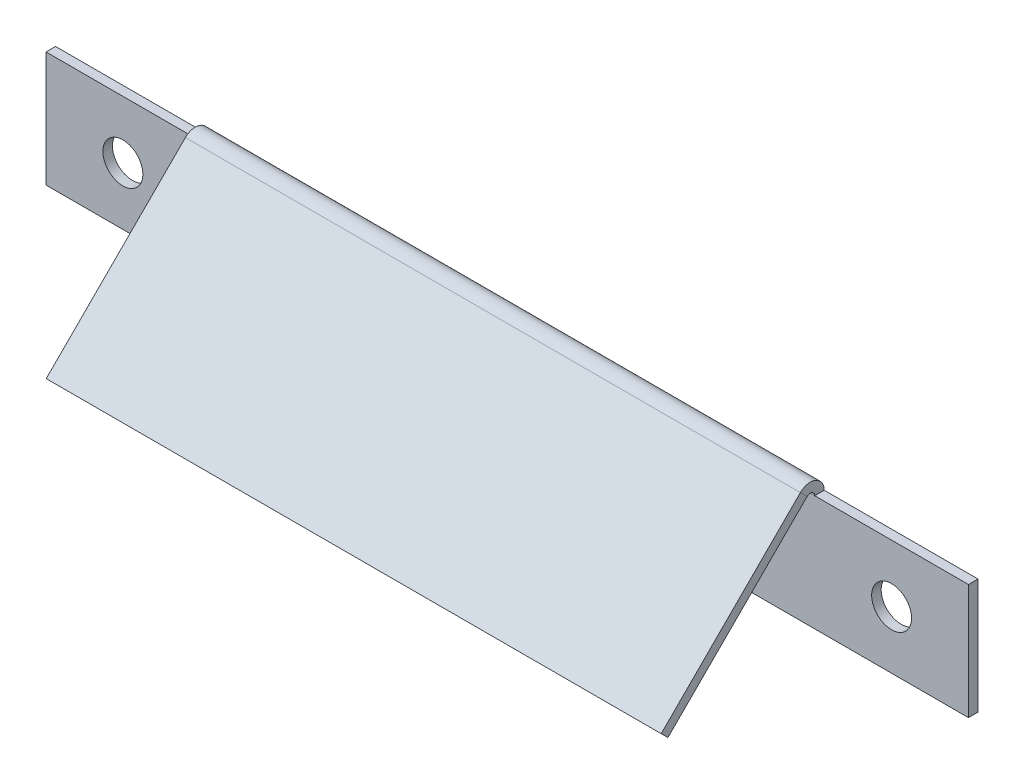
from build123d import *

# Parameters (mm, degrees)
SKETCH3_W            = 152.4
SKETCH3_H            = 19.05
BASE_FLANGE1_DEPTH   = 1.5748
EDGE_FLANGE1_DEPTH   = 101.6
M6_CLEARANCE_HOLE1_D = 6.6


# Sheet-metal steps are written as plain solids
with BuildPart() as part:
    # Sketch3 → Base-Flange1 (new body)
    with BuildSketch(Plane.XY):
        Rectangle(SKETCH3_W, SKETCH3_H)
    extrude(amount=-BASE_FLANGE1_DEPTH)

    # Edge-Flange1 section (across the edge) → Edge-Flange1 (add)
    with BuildSketch(Plane(origin=(50.8, 11.30330971, 0), x_dir=(0, -0.7071067811865488, -0.7071067811865464), z_dir=(-1, 0, 0))):
        with BuildLine():
            Line((-1.5748, 1.77830971), (-1.5748, 34.298096482))
            Line((-1.5748, 34.298096482), (0, 34.298096482))
            Line((0, 34.298096482), (0, 1.77830971))
            ThreePointArc((0, 1.77830971), (0.454715384, 1.097780046), (1.257454855, 1.257454855))
            Line((1.257454855, 1.257454855), (2.371006614, 0.143903096))
            ThreePointArc((2.371006614, 0.143903096), (-0.147934486, -0.357145441), (-1.5748, 1.77830971))
        make_face()
    extrude(amount=EDGE_FLANGE1_DEPTH)

    # M6 Clearance Hole1 (through all)
    with Locations(Plane.XY):
        with Locations((-63.5, 0), (63.5, 0)):
            Hole(M6_CLEARANCE_HOLE1_D / 2)


solid = part.part
